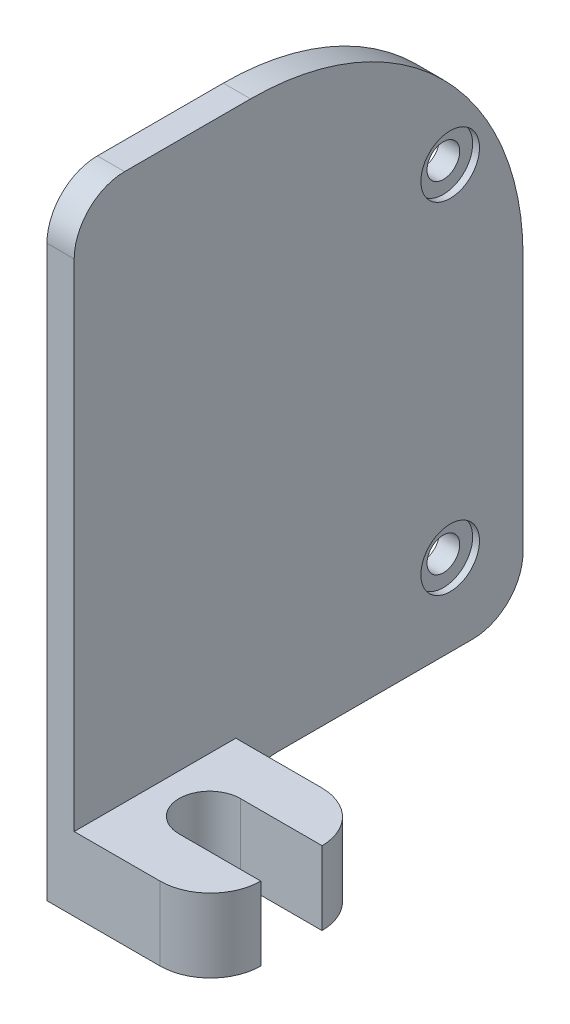
from build123d import *

# Parameters (mm, degrees)
SKETCH_1_W                = 39.896146096
SKETCH_1_H                = 53.32653191
EXTRUDE_1_DEPTH           = 2
SKETCH_2_W                = 12
SKETCH_2_H                = 39.863647893
EXTRUDE_2_DEPTH           = 10
HOLE_WIZARD_1_D           = 4.5
HOLE_WIZARD_1_CBORE_D     = 8
HOLE_WIZARD_1_CBORE_DEPTH = 4.6
SKETCH_6_W                = 10
SKETCH_6_H                = 14
CUT_EXTRUDE_1_DEPTH       = 50.184489279
SKETCH_8_W                = 7.051926952
SKETCH_8_H                = 53.179699591
EXTRUDE_3_DEPTH           = 2
CUT_EXTRUDE_2_DEPTH       = 40.24193868
HOLE_WIZARD_2_D           = 2.4
HOLE_WIZARD_2_CBORE_D     = 4.3
HOLE_WIZARD_2_CBORE_DEPTH = 0.5
SKETCH_12_W               = 21.084425155
SKETCH_12_H               = 3
CUT_EXTRUDE_3_DEPTH       = 40.24193868
FILLET_1_R                = 3
SKETCH_13_W               = 15.522379956
SKETCH_13_H               = 43.706267889
CUT_EXTRUDE_4_DEPTH       = 40.24193868
SKETCH_14_W               = 6
SKETCH_14_H               = 11.863647893
CUT_EXTRUDE_5_DEPTH       = 4.6
SKETCH_15_W               = 6
SKETCH_15_H               = 4.5
CUT_EXTRUDE_6_DEPTH       = 50.809738004
FILLET_2_R                = 3.7
FILLET_3_R                = 3.7
SKETCH_17_W               = 11.863647893
SKETCH_17_H               = 4.6
CUT_EXTRUDE_7_DEPTH       = 4


# Some blends are built 0.0001 mm under size
with BuildPart() as part:
    # 草图1 → 凸台-拉伸1 (new body)
    with BuildSketch(Plane(origin=(0, 0, 0), x_dir=(0, 0, -1), z_dir=(1, 0, 0))):
        Rectangle(SKETCH_1_W, SKETCH_1_H)
    extrude(amount=EXTRUDE_1_DEPTH)

    # 草图2 → 凸台-拉伸2 (add)
    with BuildSketch(Plane.XZ.offset(26.663265955)):
        with Locations((6, 0.016249101)):
            Rectangle(SKETCH_2_W, SKETCH_2_H)
    extrude(amount=-EXTRUDE_2_DEPTH)

    # 打孔尺寸(%根据)内六角圆柱头螺钉的类型1 (through all)
    with Locations(Plane(origin=(6, -16.663265955, 0), x_dir=(0, 0, 1), z_dir=(0, 1, 0))):
        with Locations((0, 0)):
            CounterBoreHole(HOLE_WIZARD_1_D / 2, HOLE_WIZARD_1_CBORE_D / 2, HOLE_WIZARD_1_CBORE_DEPTH)

    # 草图6 → 切除-拉伸1 (cut, through all)
    with BuildSketch(Plane(origin=(0, -16.663265955, 0), x_dir=(1, 0, 0), z_dir=(0, 1, 0))):
        with Locations((7, 12.915574845)):
            Rectangle(SKETCH_6_W, SKETCH_6_H)
        with Locations((7, -12.948073048)):
            Rectangle(SKETCH_6_W, SKETCH_6_H)
    extrude(amount=-CUT_EXTRUDE_1_DEPTH, mode=Mode.SUBTRACT)

    # 草图8 → 凸台-拉伸3 (add)
    with BuildSketch(Plane(origin=(2, 0, 0), x_dir=(0, 0, -1), z_dir=(1, 0, 0))):
        with Locations((23.474036524, -0.073416159)):
            Rectangle(SKETCH_8_W, SKETCH_8_H)
    extrude(amount=-EXTRUDE_3_DEPTH)

    # 草图9 → 切除-拉伸2 (cut, through all)
    with BuildSketch(Plane(origin=(2, 0, 0), x_dir=(0, 0, -1), z_dir=(1, 0, 0))):
        with BuildLine():
            ThreePointArc((-10.54, 13.836734045), (-9.075533906, 17.372267951), (-5.54, 18.836734045))
            Line((-5.54, 18.836734045), (7, 18.836734045))
            ThreePointArc((7, 18.836734045), (21.142135624, 12.978869669), (27, -1.163265955))
            Line((27, -1.163265955), (27, 26.516433636))
            Line((27, 26.516433636), (19.948073048, 26.516433636))
            Line((19.948073048, 26.516433636), (19.948073048, 26.663265955))
            Line((19.948073048, 26.663265955), (-19.948073048, 26.663265955))
            Line((-19.948073048, 26.663265955), (-19.948073048, -3.722994561))
            ThreePointArc((-19.948073048, -3.722994561), (-17.113911838, 5.186324453), (-10.54, 11.834039714))
            Line((-10.54, 11.834039714), (-10.54, 13.836734045))
        make_face()
        with BuildLine():
            ThreePointArc((-5.948073048, -24.258302666), (-15.670841721, -17.590040264), (-19.948073048, -6.603537348))
            Line((-19.948073048, -6.603537348), (-19.948073048, -26.663265955))
            Line((-19.948073048, -26.663265955), (-5.948073048, -26.663265955))
            Line((-5.948073048, -26.663265955), (-5.948073048, -24.258302666))
        make_face()
    extrude(amount=-CUT_EXTRUDE_2_DEPTH, mode=Mode.SUBTRACT)

    # 打孔尺寸(%根据)内六角圆柱头螺钉的类型2 (through all)
    with Locations(Plane(origin=(2, 7.336734045, -21.650635095), x_dir=(0, 0, 1), z_dir=(1, 0, 0))):
        with Locations((0, 0), (0, 25)):
            CounterBoreHole(HOLE_WIZARD_2_D / 2, HOLE_WIZARD_2_CBORE_D / 2, HOLE_WIZARD_2_CBORE_DEPTH)

    # 草图12 → 切除-拉伸3 (cut, through all)
    with BuildSketch(Plane(origin=(2, 0, 0), x_dir=(0, 0, -1), z_dir=(1, 0, 0))):
        with Locations((16.457787423, -25.163265955)):
            Rectangle(SKETCH_12_W, SKETCH_12_H)
    extrude(amount=-CUT_EXTRUDE_3_DEPTH, mode=Mode.SUBTRACT)

    # 圆角1
    fillet_1_edges = [part.edges().sort_by_distance(p)[0] for p in [
        (1, -23.663265955, -5.915574845),
    ]]
    fillet(fillet_1_edges, radius=FILLET_1_R - 0.0001)  # a hair under: the kernel refuses the full size

    # 草图13 → 切除-拉伸4 (cut, through all)
    with BuildSketch(Plane(origin=(2, 0, 0), x_dir=(0, 0, -1), z_dir=(1, 0, 0))):
        with Locations((-13.709263026, -2.405168722)):
            Rectangle(SKETCH_13_W, SKETCH_13_H)
    extrude(amount=-CUT_EXTRUDE_4_DEPTH, mode=Mode.SUBTRACT)

    # 草图14 → 切除-拉伸5 (cut)
    with BuildSketch(Plane(origin=(0, -16.663265955, 0), x_dir=(1, 0, 0), z_dir=(0, 1, 0))):
        with Locations((9, -0.016249102)):
            Rectangle(SKETCH_14_W, SKETCH_14_H)
    extrude(amount=-CUT_EXTRUDE_5_DEPTH, mode=Mode.SUBTRACT)

    # 草图15 → 切除-拉伸6 (cut, through all)
    with BuildSketch(Plane(origin=(0, -21.263265955, 0), x_dir=(1, 0, 0), z_dir=(0, 1, 0))):
        with Locations((9, 0)):
            Rectangle(SKETCH_15_W, SKETCH_15_H)
    extrude(amount=-CUT_EXTRUDE_6_DEPTH, mode=Mode.SUBTRACT)

    # 圆角2
    # the kernel refuses this fillet: 3.7 mm, written as the material it takes off along each edge
    with BuildSketch(Plane(origin=(12, -12.013265955, -5.915574845), x_dir=(-1, 0, 0), z_dir=(0, -1, 0))) as fillet_2_piece_1:
        with BuildLine():
            CenterArc((FILLET_2_R, -FILLET_2_R), FILLET_2_R, 90, 90)
            Line((0, -FILLET_2_R), (0, 0))
            Line((0, 0), (FILLET_2_R, 0))
        make_face()
    extrude(amount=23.9, mode=Mode.SUBTRACT)
    with BuildSketch(Plane(origin=(12, -12.013265955, 5.948073048), x_dir=(-1, 0, 0), z_dir=(0, -1, 0))) as fillet_2_piece_2:
        with BuildLine():
            CenterArc((FILLET_2_R, FILLET_2_R), FILLET_2_R, 180, 90)
            Line((0, FILLET_2_R), (0, 0))
            Line((0, 0), (FILLET_2_R, 0))
        make_face()
    extrude(amount=23.9, mode=Mode.SUBTRACT)

    # 圆角3
    # the kernel refuses this fillet: 3.7 mm, written as the material it takes off along each edge
    with BuildSketch(Plane(origin=(11.25, -23.663265955, -27), x_dir=(0, 1, 0), z_dir=(-1, 0, 0))) as fillet_3_piece_1:
        with BuildLine():
            CenterArc((FILLET_3_R, -FILLET_3_R), FILLET_3_R, 90, 90)
            Line((0, -FILLET_3_R), (0, 0))
            Line((0, 0), (FILLET_3_R, 0))
        make_face()
    extrude(amount=20.5, mode=Mode.SUBTRACT)
    with BuildSketch(Plane(origin=(-9.250093996, 18.820053861, 5.948073048), x_dir=(0, -1, 0), z_dir=(1, 0, 0))) as fillet_3_piece_2:
        with BuildLine():
            CenterArc((3.683319816, 3.7), FILLET_3_R, 180, 90)
            Line((-0.016680184, 3.7), (-0.386680184, 3.7))
            ThreePointArc((-0.386680184, 3.7), (-0.386680184, 0.408073048), (-0.368765666, -0.030197406))
            Line((-0.368765666, -0.030197406), (0, -0.37))
            Line((0, -0.37), (3.683319816, -0.37))
            Line((3.683319816, -0.37), (3.683319816, 0))
        make_face()
    extrude(amount=20.500187991, mode=Mode.SUBTRACT)

    # 草图17 → 切除-拉伸7 (cut)
    with BuildSketch(Plane(origin=(6, 0, 0), x_dir=(0, 0, -1), z_dir=(1, 0, 0))):
        with Locations((-0.016249102, -18.963265955)):
            Rectangle(SKETCH_17_W, SKETCH_17_H)
    extrude(amount=-CUT_EXTRUDE_7_DEPTH, mode=Mode.SUBTRACT)


solid = part.part
